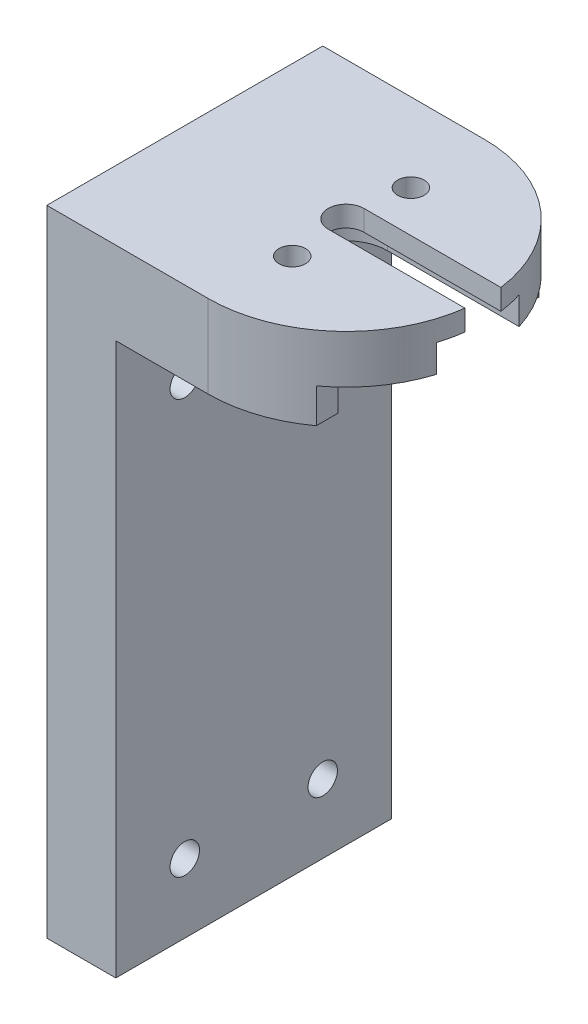
from build123d import *

# Parameters (mm, degrees)
BOSS_EXTRUDE1_DEPTH       = 25.4
SKETCH2_W                 = 16.51
SKETCH2_H                 = 1.964574829
SKETCH2_H_2               = 1.210425171
CUT_EXTRUDE1_DEPTH        = 16.002
CUT_EXTRUDE2_DEPTH        = 4.445
CUT_EXTRUDE3_DEPTH        = 2.54
FILLET1_R                 = 12.7
F_2_CLEARANCE_HOLE1_D     = 2.4384
F_2_CLEARANCE_HOLE1_DEPTH = 25.4
F_2_CLEARANCE_HOLE1_TIP   = 0.732569267
F_6_32_TAPPED_HOLE1_D     = 2.7051
F_6_32_TAPPED_HOLE1_DEPTH = 9.398
F_6_32_TAPPED_HOLE1_TIP   = 0.81269403
CUT_EXTRUDE4_REACH        = 70.674


with BuildPart() as part:
    # Sketch1 → Boss-Extrude1 (new body)
    with BuildSketch(Plane.XY):
        Polygon((-22.352, -53.975), (-16.002, -53.975), (-16.002, -3.175), (0, -3.175), (0, 0), (25.654, 0), (25.654, 4.445), (-22.352, 4.445), align=None)
    extrude(amount=BOSS_EXTRUDE1_DEPTH)

    # Sketch2 → Cut-Extrude1 (cut)
    with BuildSketch(Plane(origin=(0, 0, 0), x_dir=(0, 0, -1), z_dir=(1, 0, 0))):
        with Locations((-12.7, -0.982287415)):
            Rectangle(SKETCH2_W, SKETCH2_H)
        with Locations((-12.7, -2.569787415)):
            Rectangle(SKETCH2_W, SKETCH2_H_2)
    extrude(amount=-CUT_EXTRUDE1_DEPTH, mode=Mode.SUBTRACT)

    # Sketch3 → Cut-Extrude2 (cut)
    with BuildSketch(Plane.XZ):
        with BuildLine():
            Line((-7.502, 14.351), (11.5, 14.351))
            ThreePointArc((11.5, 14.351), (13.151, 12.7), (11.5, 11.049))
            Line((11.5, 11.049), (-7.502, 11.049))
            ThreePointArc((-7.502, 11.049), (-9.153, 12.7), (-7.502, 14.351))
        make_face()
    extrude(amount=-CUT_EXTRUDE2_DEPTH, mode=Mode.SUBTRACT)

    # Sketch4 → Cut-Extrude3 (cut)
    with BuildSketch(Plane.XZ):
        with BuildLine():
            Line((-7.502, 16.51), (11.5, 16.51))
            ThreePointArc((11.5, 16.51), (15.31, 12.7), (11.5, 8.89))
            Line((11.5, 8.89), (-7.502, 8.89))
            ThreePointArc((-7.502, 8.89), (-11.312, 12.7), (-7.502, 16.51))
        make_face()
    extrude(amount=-CUT_EXTRUDE3_DEPTH, mode=Mode.SUBTRACT)

    # Fillet1
    fillet1_edges = [part.edges().sort_by_distance(p)[0] for p in [
        (25.654, 2.2225, 0),
        (25.654, 2.2225, 25.4),
    ]]
    fillet(fillet1_edges, radius=FILLET1_R - 0.0001)  # a hair under: the kernel refuses the full size

    # #2 Clearance Hole1
    with Locations(Plane(origin=(0, 4.445, 0), x_dir=(1, 0, 0), z_dir=(0, 1, 0))):
        with Locations((-7.002, -18.16), (-7.002, -7.24)):
            Hole(F_2_CLEARANCE_HOLE1_D / 2, depth=F_2_CLEARANCE_HOLE1_DEPTH)
            with Locations((0, 0, -(F_2_CLEARANCE_HOLE1_DEPTH + F_2_CLEARANCE_HOLE1_TIP / 2))):  # 118° drill point
                Cone(0, F_2_CLEARANCE_HOLE1_D / 2, F_2_CLEARANCE_HOLE1_TIP, mode=Mode.SUBTRACT)

    # #6-32 Tapped Hole1
    with Locations(Plane.ZY.offset(22.352)):
        with Locations((6.35, -9.525), (19.05, -9.525), (6.35, -47.625), (19.05, -47.625)):
            Hole(F_6_32_TAPPED_HOLE1_D / 2, depth=F_6_32_TAPPED_HOLE1_DEPTH)
            with Locations((0, 0, -(F_6_32_TAPPED_HOLE1_DEPTH + F_6_32_TAPPED_HOLE1_TIP / 2))):  # 118° drill point
                Cone(0, F_6_32_TAPPED_HOLE1_D / 2, F_6_32_TAPPED_HOLE1_TIP, mode=Mode.SUBTRACT)

    # Cut-Extrude4: up to this face of the body (flat: up to its plane)
    cut_extrude4_end = Plane(part.part.faces().sort_by_distance((-8.001, -3.175, 23.1775))[0])
    # Sketch10 → Cut-Extrude4 (cut, up to the picked face)
    with BuildSketch(Plane(origin=(0, 4.445, 0), x_dir=(1, 0, 0), z_dir=(0, 1, 0)), mode=Mode.PRIVATE) as cut_extrude4_sk1:
        with BuildLine():
            Line((-7.502, -25.4), (30.598, -25.4))
            Line((30.598, -25.4), (30.598, 0))
            Line((30.598, 0), (-7.502, 0))
            ThreePointArc((-7.502, 0), (5.198, -12.7), (-7.502, -25.4))
        make_face()
    cut_extrude4_tool1 = split(extrude(cut_extrude4_sk1.sketch, amount=-CUT_EXTRUDE4_REACH, mode=Mode.PRIVATE), bisect_by=cut_extrude4_end, keep=Keep.BOTH, mode=Mode.PRIVATE)
    add(cut_extrude4_tool1.solids().sort_by(Axis((16.392438, 4.445, 12.7), (0, -1, 0)))[0], mode=Mode.SUBTRACT)


solid = part.part
